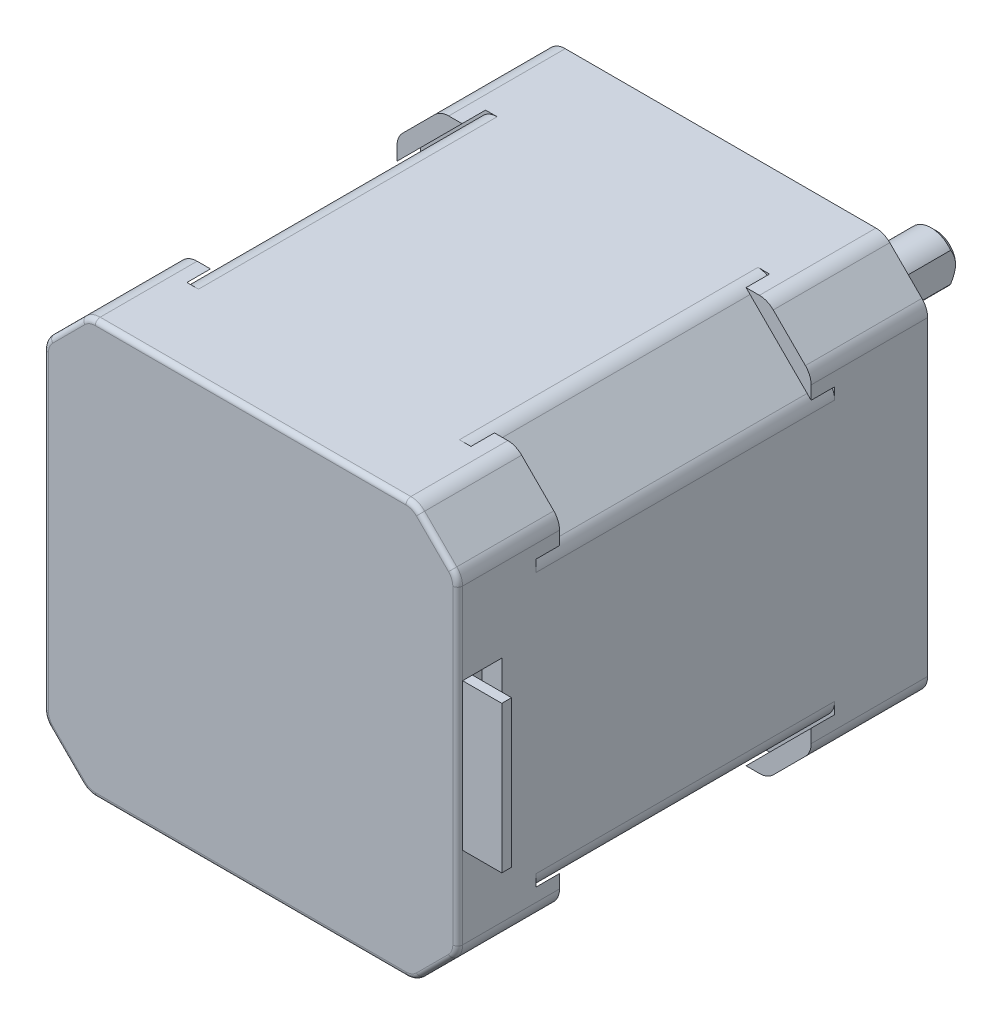
from build123d import *

# Parameters (mm, degrees)
SKETCH1_W         = 42.3
SKETCH1_H         = 42.3
EXTRUSION1_DEPTH  = 48
CHAMFER1_SIZE     = 7
EXTRUSION2_DEPTH  = 8
EXTRUSION3_DEPTH  = 9.5
EXTRUSION4_DEPTH  = 2.4
EXTRUSION5_DEPTH  = 2.4
FILLET1_R         = 0.5
FILLET2_R         = 2
SKETCH6_R         = 11
EXTRUSION6_DEPTH  = 2
EXTRUSION7_START  = -0.4
SKETCH7_R         = 16.25
SKETCH7_R_2       = 11
EXTRUSION7_DEPTH  = 0.4
SKETCH8_R         = 2.5
EXTRUSION8_DEPTH  = 20
CHAMFER2_SIZE     = 0.5
EXTRUSION9_START  = -3
SKETCH9_R         = 3.4
SKETCH9_R_2       = 2.5
EXTRUSION9_DEPTH  = 3
HOLE1_D           = 2.459
HOLE1_DEPTH       = 4.5
HOLE1_TIP         = 0.738758131
EXTRUSION10_START = -20
EXTRUSION10_DEPTH = 20
SKETCH13_W        = 4
SKETCH13_H        = 15
EXTRUSION11_DEPTH = 4
SKETCH14_W        = 3
SKETCH14_H        = 15
EXTRUSION12_DEPTH = 6


with BuildPart() as part:
    # Sketch1 → Extrusion1 (new body)
    with BuildSketch(Plane.XY):
        Rectangle(SKETCH1_W, SKETCH1_H)
    extrude(amount=EXTRUSION1_DEPTH)

    # Chamfer1
    chamfer1_edges = [part.edges().sort_by_distance(p)[0] for p in [
        (-21.15, 21.15, 24),
        (21.15, 21.15, 24),
        (21.15, -21.15, 24),
        (-21.15, -21.15, 24),
    ]]
    chamfer(chamfer1_edges, length=CHAMFER1_SIZE)

    # Sketch2 → Extrusion2 (add)
    with BuildSketch(Plane.XY.offset(48)):
        Polygon((-16.695584412, 21.15), (-21.15, 16.695584412), (-21.15, 14.15), (-14.15, 21.15), align=None)
        Polygon((21.15, 14.15), (21.15, 16.695584412), (16.695584412, 21.15), (14.15, 21.15), align=None)
        Polygon((14.15, -21.15), (16.695584412, -21.15), (21.15, -16.695584412), (21.15, -14.15), align=None)
        Polygon((-21.15, -14.15), (-21.15, -16.695584412), (-16.695584412, -21.15), (-14.15, -21.15), align=None)
    extrude(amount=-EXTRUSION2_DEPTH)

    # Sketch3 → Extrusion3 (add)
    with BuildSketch(Plane(origin=(0, 0, 0), x_dir=(-1, 0, 0), z_dir=(0, 0, -1))):
        Polygon((16.695584412, -21.15), (21.15, -16.695584412), (21.15, -14.15), (14.15, -21.15), align=None)
        Polygon((-16.695584412, 21.15), (-14.15, 21.15), (-21.15, 14.15), (-21.15, 16.695584412), align=None)
        Polygon((21.15, 14.15), (21.15, 16.695584412), (16.695584412, 21.15), (14.15, 21.15), align=None)
        Polygon((-21.15, -16.695584412), (-16.695584412, -21.15), (-14.15, -21.15), (-21.15, -14.15), align=None)
    extrude(amount=-EXTRUSION3_DEPTH)

    # Sketch4 → Extrusion4 (add)
    with BuildSketch(Plane(origin=(0, 0, 40), x_dir=(-1, 0, 0), z_dir=(0, 0, -1))):
        Polygon((-14.503553391, -21.15), (-21.15, -14.503553391), (-21.15, -16.695584412), (-16.695584412, -21.15), align=None)
        Polygon((16.695584412, -21.15), (14.503553391, -21.15), (21.15, -14.503553391), (21.15, -16.695584412), align=None)
        Polygon((21.15, 16.695584412), (21.15, 14.503553391), (14.503553391, 21.15), (16.695584412, 21.15), align=None)
        Polygon((-16.695584412, 21.15), (-14.503553391, 21.15), (-21.15, 14.503553391), (-21.15, 16.695584412), align=None)
    extrude(amount=EXTRUSION4_DEPTH)

    # Sketch5 → Extrusion5 (add)
    with BuildSketch(Plane.XY.offset(9.5)):
        Polygon((16.695584412, 21.15), (21.15, 16.695584412), (21.15, 14.503553391), (14.503553391, 21.15), align=None)
        Polygon((-21.15, 16.695584412), (-16.695584412, 21.15), (-14.503553391, 21.15), (-21.15, 14.503553391), align=None)
        Polygon((14.503553391, -21.15), (21.15, -14.503553391), (21.15, -16.695584412), (16.695584412, -21.15), align=None)
        Polygon((-14.503553391, -21.15), (-21.15, -14.503553391), (-21.15, -16.695584412), (-16.695584412, -21.15), align=None)
    extrude(amount=EXTRUSION5_DEPTH)

    # Fillet1
    fillet1_edges = [part.edges().sort_by_distance(p)[0] for p in [
        (-21.15, 0, 48),
        (0, 21.15, 48),
        (0, -21.15, 48),
        (21.15, 0, 48),
        (-18.922792206, 18.922792206, 48),
        (18.922792206, 18.922792206, 48),
        (18.922792206, -18.922792206, 48),
        (-18.922792206, -18.922792206, 48),
    ]]
    fillet(fillet1_edges, radius=FILLET1_R)

    # Fillet2
    # the kernel refuses this fillet: 2 mm, written as the material it takes off along each edge
    with BuildSketch(Plane(origin=(15.867157288, 19.15, 48), x_dir=(0.7071067811865476, 0.7071067811865476, 0), z_dir=(0.7071067811865476, -0.7071067811865476, 0))) as fillet2_piece_1:
        with BuildLine():
            CenterArc((1.5, -0.5), 0.5, 0, 90)
            Line((2, -0.5), (2, 0))
            Line((2, 0), (1.5, 0))
        make_face()
    revolve(axis=Axis((15.867157288, 19.15, 48), (0, 0, 1)), revolution_arc=45, mode=Mode.SUBTRACT)
    with BuildSketch(Plane(origin=(19.15, 15.867157288, 48), x_dir=(1, 0, 0), z_dir=(0, -1, 0))) as fillet2_piece_2:
        with BuildLine():
            CenterArc((1.5, -0.5), 0.5, 0, 90)
            Line((2, -0.5), (2, 0))
            Line((2, 0), (1.5, 0))
        make_face()
    revolve(axis=Axis((19.15, 15.867157288, 48), (0, 0, 1)), revolution_arc=45, mode=Mode.SUBTRACT)
    with BuildSketch(Plane(origin=(-15.867157288, 19.15, 48), x_dir=(0, 1, 0), z_dir=(1, 0, 0))) as fillet2_piece_3:
        with BuildLine():
            CenterArc((1.5, -0.5), 0.5, 0, 90)
            Line((2, -0.5), (2, 0))
            Line((2, 0), (1.5, 0))
        make_face()
    revolve(axis=Axis((-15.867157288, 19.15, 48), (0, 0, 1)), revolution_arc=45, mode=Mode.SUBTRACT)
    with BuildSketch(Plane(origin=(19.15, -15.867157288, 48), x_dir=(0.7071067811865472, -0.7071067811865478, 0), z_dir=(-0.7071067811865478, -0.7071067811865472, 0))) as fillet2_piece_4:
        with BuildLine():
            CenterArc((1.5, -0.5), 0.5, 0, 90)
            Line((2, -0.5), (2, 0))
            Line((2, 0), (1.5, 0))
        make_face()
    revolve(axis=Axis((19.15, -15.867157288, 48), (0, 0, 1)), revolution_arc=45, mode=Mode.SUBTRACT)
    with BuildSketch(Plane(origin=(-19.15, 15.867157288, 48), x_dir=(-0.7071067811865476, 0.7071067811865476, 0), z_dir=(0.7071067811865476, 0.7071067811865476, 0))) as fillet2_piece_5:
        with BuildLine():
            CenterArc((1.5, -0.5), 0.5, 0, 90)
            Line((2, -0.5), (2, 0))
            Line((2, 0), (1.5, 0))
        make_face()
    revolve(axis=Axis((-19.15, 15.867157288, 48), (0, 0, 1)), revolution_arc=45, mode=Mode.SUBTRACT)
    with BuildSketch(Plane(origin=(15.867157288, -19.15, 48), x_dir=(0, -1, 0), z_dir=(-1, 0, 0))) as fillet2_piece_6:
        with BuildLine():
            CenterArc((1.5, -0.5), 0.5, 0, 90)
            Line((2, -0.5), (2, 0))
            Line((2, 0), (1.5, 0))
        make_face()
    revolve(axis=Axis((15.867157288, -19.15, 48), (0, 0, 1)), revolution_arc=45, mode=Mode.SUBTRACT)
    with BuildSketch(Plane(origin=(-19.15, -15.867157288, 48), x_dir=(-1, 0, 0), z_dir=(0, 1, 0))) as fillet2_piece_7:
        with BuildLine():
            CenterArc((1.5, -0.5), 0.5, 0, 90)
            Line((2, -0.5), (2, 0))
            Line((2, 0), (1.5, 0))
        make_face()
    revolve(axis=Axis((-19.15, -15.867157288, 48), (0, 0, 1)), revolution_arc=45, mode=Mode.SUBTRACT)
    with BuildSketch(Plane(origin=(-15.867157288, -19.15, 48), x_dir=(-0.7071067811865479, -0.7071067811865474, 0), z_dir=(-0.7071067811865474, 0.7071067811865479, 0))) as fillet2_piece_8:
        with BuildLine():
            CenterArc((1.5, -0.5), 0.5, 0, 90)
            Line((2, -0.5), (2, 0))
            Line((2, 0), (1.5, 0))
        make_face()
    revolve(axis=Axis((-15.867157288, -19.15, 48), (0, 0, 1)), revolution_arc=45, mode=Mode.SUBTRACT)
    with BuildSketch(Plane(origin=(21.15, 16.695584412, 13.971067812), x_dir=(-0.7071067811865475, 0.7071067811865475, 0), z_dir=(0, 0, -1)), Plane(origin=(-16.695584412, 21.15, -2.071067812), x_dir=(1, 0, 0), z_dir=(0, 0, 1)), Plane(origin=(-21.15, 16.695584412, -2.071067812), x_dir=(0.7071067811865475, 0.7071067811865475, 0), z_dir=(0, 0, 1)), Plane(origin=(21.15, -16.695584412, 13.971067812), x_dir=(0, 1, 0), z_dir=(0, 0, -1)), Plane(origin=(-21.15, -16.695584412, -2.071067812), x_dir=(0, 1, 0), z_dir=(0, 0, 1)), Plane(origin=(-16.695584412, -21.15, 13.971067812), x_dir=(1, 0, 0), z_dir=(0, 0, -1)), Plane(origin=(16.695584412, 21.15, 13.971067812), x_dir=(-1, 0, 0), z_dir=(0, 0, -1))) as fillet2_piece_9:
        with BuildLine():
            CenterArc((FILLET2_R * 0.414213562373, -FILLET2_R), FILLET2_R, 90, 45)
            Line((-FILLET2_R * 0.292893218813, -FILLET2_R * 0.292893218813), (0, 0))
            Line((0, 0), (FILLET2_R * 0.414213562373, 0))
        make_face()
    extrude(amount=16.042135624, mode=Mode.SUBTRACT)
    with BuildSketch(Plane(origin=(-14.15, 21.15, 9.5), x_dir=(1, 0, 0), z_dir=(0, 0, 1)), Plane(origin=(14.15, -21.15, 9.5), x_dir=(-1, 0, 0), z_dir=(0, 0, 1)), Plane(origin=(-21.15, 14.15, 9.5), x_dir=(0.7071067811865486, 0.7071067811865465, 0), z_dir=(0, 0, 1)), Plane(origin=(-21.15, -14.15, 9.5), x_dir=(0, 1, 0), z_dir=(0, 0, 1))) as fillet2_piece_10:
        with BuildLine():
            CenterArc((FILLET2_R * 0.414213562373, -FILLET2_R), FILLET2_R, 90, 45)
            Line((-FILLET2_R * 0.292893218813, -FILLET2_R * 0.292893218813), (0, 0))
            Line((0, 0), (FILLET2_R * 0.414213562373, 0))
        make_face()
    extrude(amount=30.5, mode=Mode.SUBTRACT)
    with BuildSketch(Plane(origin=(16.695584412, -21.15, -2.071067812), x_dir=(0.7071067811865475, 0.7071067811865475, 0), z_dir=(0, 0, 1))) as fillet2_piece_11:
        with BuildLine():
            CenterArc((FILLET2_R * 0.414213562373, FILLET2_R), FILLET2_R, 225, 45)
            Line((-FILLET2_R * 0.292893218813, FILLET2_R * 0.292893218813), (0, 0))
            Line((0, 0), (FILLET2_R * 0.414213562373, 0))
        make_face()
    extrude(amount=16.042135624, mode=Mode.SUBTRACT)
    with BuildSketch(Plane(origin=(-21.15, 16.695584412, 35.528932188), x_dir=(0.7071067811865475, 0.7071067811865475, 0), z_dir=(0, 0, 1)), Plane(origin=(-16.695584412, 21.15, 35.528932188), x_dir=(1, 0, 0), z_dir=(0, 0, 1)), Plane(origin=(21.15, 16.695584412, 48), x_dir=(-0.7071067811865475, 0.7071067811865475, 0), z_dir=(0, 0, -1)), Plane(origin=(16.695584412, 21.15, 48), x_dir=(-1, 0, 0), z_dir=(0, 0, -1)), Plane(origin=(21.15, -16.695584412, 48), x_dir=(0, 1, 0), z_dir=(0, 0, -1)), Plane(origin=(-21.15, -16.695584412, 35.528932188), x_dir=(0, 1, 0), z_dir=(0, 0, 1)), Plane(origin=(-16.695584412, -21.15, 48), x_dir=(1, 0, 0), z_dir=(0, 0, -1))) as fillet2_piece_12:
        with BuildLine():
            CenterArc((FILLET2_R * 0.414213562373, -FILLET2_R), FILLET2_R, 90, 45)
            Line((-FILLET2_R * 0.292893218813, -FILLET2_R * 0.292893218813), (0, 0))
            Line((0, 0), (FILLET2_R * 0.414213562373, 0))
        make_face()
    extrude(amount=12.471067812, mode=Mode.SUBTRACT)
    with BuildSketch(Plane(origin=(14.15, 21.15, 9.5), x_dir=(-1, 0, 0), z_dir=(0, 0, 1)), Plane(origin=(21.15, -14.15, 9.5), x_dir=(0, 1, 0), z_dir=(0, 0, 1)), Plane(origin=(-14.15, -21.15, 9.5), x_dir=(1, 0, 0), z_dir=(0, 0, 1)), Plane(origin=(21.15, 14.15, 9.5), x_dir=(-0.7071067811865486, 0.7071067811865465, 0), z_dir=(0, 0, 1))) as fillet2_piece_13:
        with BuildLine():
            CenterArc((FILLET2_R * 0.414213562373, FILLET2_R), FILLET2_R, 225, 45)
            Line((-FILLET2_R * 0.292893218813, FILLET2_R * 0.292893218813), (0, 0))
            Line((0, 0), (FILLET2_R * 0.414213562373, 0))
        make_face()
    extrude(amount=30.5, mode=Mode.SUBTRACT)
    with BuildSketch(Plane(origin=(16.695584412, -21.15, 48), x_dir=(-1, 0, 0), z_dir=(0, 0, -1))) as fillet2_piece_14:
        with BuildLine():
            CenterArc((FILLET2_R * 0.414213562373, FILLET2_R), FILLET2_R, 225, 45)
            Line((-FILLET2_R * 0.292893218813, FILLET2_R * 0.292893218813), (0, 0))
            Line((0, 0), (FILLET2_R * 0.414213562373, 0))
        make_face()
    extrude(amount=12.471067812, mode=Mode.SUBTRACT)

    # Sketch6 → Extrusion6 (add)
    with BuildSketch(Plane(origin=(0, 0, 0), x_dir=(-1, 0, 0), z_dir=(0, 0, -1))):
        Circle(SKETCH6_R)
    extrude(amount=EXTRUSION6_DEPTH)

    # Sketch7 → Extrusion7 (cut)
    with BuildSketch(Plane(origin=(0, 0, 0), x_dir=(-1, 0, 0), z_dir=(0, 0, -1)).offset(EXTRUSION7_START)):
        Circle(SKETCH7_R)
        Circle(SKETCH7_R_2, mode=Mode.SUBTRACT)
    extrude(amount=EXTRUSION7_DEPTH, mode=Mode.SUBTRACT)

    # Sketch8 → Extrusion8 (add)
    with BuildSketch(Plane(origin=(0, 0, -2), x_dir=(-1, 0, 0), z_dir=(0, 0, -1))):
        Circle(SKETCH8_R)
    extrude(amount=EXTRUSION8_DEPTH)

    # Chamfer2
    chamfer2_edges = [part.edges().sort_by_distance(p)[0] for p in [
        (2.5, 0, -22),
    ]]
    chamfer(chamfer2_edges, length=CHAMFER2_SIZE)

    # Sketch9 → Extrusion9 (cut)
    with BuildSketch(Plane(origin=(0, 0, -2), x_dir=(-1, 0, 0), z_dir=(0, 0, -1)).offset(EXTRUSION9_START)):
        Circle(SKETCH9_R)
        Circle(SKETCH9_R_2, mode=Mode.SUBTRACT)
    extrude(amount=EXTRUSION9_DEPTH, mode=Mode.SUBTRACT)

    # Hole1
    with Locations(Plane(origin=(0, 0, 0), x_dir=(-1, 0, 0), z_dir=(0, 0, -1))):
        with Locations((-15.5, 15.5), (15.5, 15.5), (15.5, -15.5), (-15.5, -15.5)):
            Hole(HOLE1_D / 2, depth=HOLE1_DEPTH)
            with Locations((0, 0, -(HOLE1_DEPTH + HOLE1_TIP / 2))):  # 118° drill point
                Cone(0, HOLE1_D / 2, HOLE1_TIP, mode=Mode.SUBTRACT)

    # Sketch12 → Extrusion10 (cut)
    with BuildSketch(Plane(origin=(0, 0, -22), x_dir=(-1, 0, 0), z_dir=(0, 0, -1)).offset(EXTRUSION10_START)):
        with BuildLine():
            Line((-2, -1.5), (-2, 1.5))
            ThreePointArc((-2, 1.5), (-2.5, 0), (-2, -1.5))
        make_face()
    extrude(amount=EXTRUSION10_DEPTH, mode=Mode.SUBTRACT)

    # Sketch13 → Extrusion11 (add)
    with BuildSketch(Plane(origin=(21.15, 0, 0), x_dir=(0, 0, -1), z_dir=(1, 0, 0))):
        with Locations((-45.5, 0)):
            Rectangle(SKETCH13_W, SKETCH13_H)
    extrude(amount=EXTRUSION11_DEPTH)

    # Sketch14 → Extrusion12 (cut)
    with BuildSketch(Plane(origin=(25.15, 14.503553391, 40), x_dir=(0, 0, -1), z_dir=(1, 0, 0))):
        with Locations((-5, -14.503553391)):
            Rectangle(SKETCH14_W, SKETCH14_H)
    extrude(amount=-EXTRUSION12_DEPTH, mode=Mode.SUBTRACT)


solid = part.part
